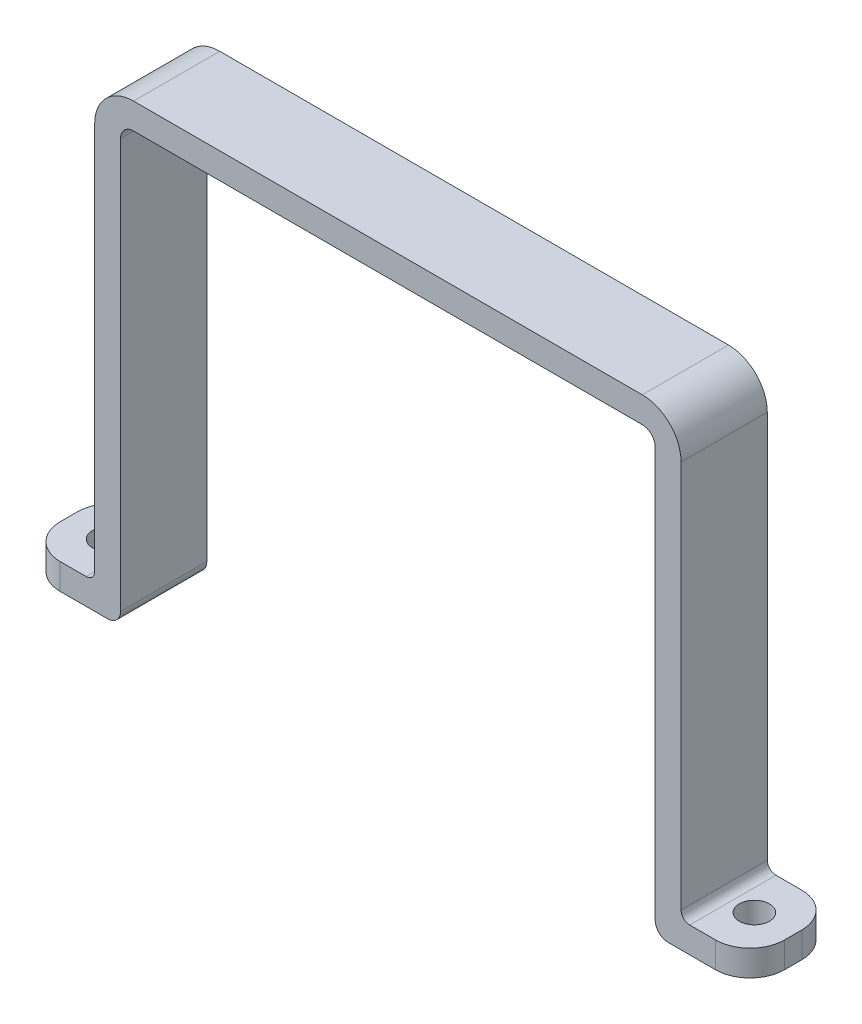
from build123d import *

# Parameters (mm, degrees)
SALIENTE_EXTRUIR1_DEPTH = 5
REDONDEO1_R             = 4
CROQUIS2_R              = 1.75
CORTAR_EXTRUIR1_DEPTH   = 99.138932132
REDONDEO2_R             = 1.5
REDONDEO3_R             = 4.5
REDONDEO4_R             = 1.5
REDONDEO5_R             = 1


with BuildPart() as part:
    # Croquis1 → Saliente-Extruir1 (new, symmetric)
    with BuildSketch(Plane.XY):
        Polygon((0, 0), (11, 0), (11, 50.5), (73, 50.5), (73, 0), (84, 0), (84, 3), (76, 3), (76, 53.5), (8, 53.5), (8, 3), (0, 3), align=None)
    extrude(amount=SALIENTE_EXTRUIR1_DEPTH, both=True)

    # Redondeo1
    redondeo1_edges = [part.edges().sort_by_distance(p)[0] for p in [
        (0, 1.5, -5),
        (0, 1.5, 5),
        (84, 1.5, -5),
        (84, 1.5, 5),
    ]]
    fillet(redondeo1_edges, radius=REDONDEO1_R)

    # Croquis2 → Cortar-Extruir1 (cut, through all)
    with BuildSketch(Plane(origin=(0, 3, 0), x_dir=(1, 0, 0), z_dir=(0, 1, 0))):
        with Locations((79.5, 0)):
            Circle(CROQUIS2_R)
    cortar_extruir1 = extrude(amount=-CORTAR_EXTRUIR1_DEPTH, mode=Mode.SUBTRACT)

    # Simetría1: Cortar-Extruir1 across plane
    add(cortar_extruir1.mirror(Plane(origin=(42, 0, 0), x_dir=(0, 0, 1), z_dir=(1, 0, 0))), mode=Mode.SUBTRACT)

    # Redondeo2
    redondeo2_edges = [part.edges().sort_by_distance(p)[0] for p in [
        (11, 50.5, 0),
        (73, 50.5, 0),
    ]]
    fillet(redondeo2_edges, radius=REDONDEO2_R)

    # Redondeo3
    redondeo3_edges = [part.edges().sort_by_distance(p)[0] for p in [
        (76, 53.5, 0),
        (8, 53.5, 0),
    ]]
    fillet(redondeo3_edges, radius=REDONDEO3_R)

    # Redondeo4
    redondeo4_edges = [part.edges().sort_by_distance(p)[0] for p in [
        (73, 0, 0),
        (11, 0, 0),
    ]]
    fillet(redondeo4_edges, radius=REDONDEO4_R)

    # Redondeo5
    redondeo5_edges = [part.edges().sort_by_distance(p)[0] for p in [
        (76, 3, 0),
        (8, 3, 0),
    ]]
    fillet(redondeo5_edges, radius=REDONDEO5_R)


solid = part.part
